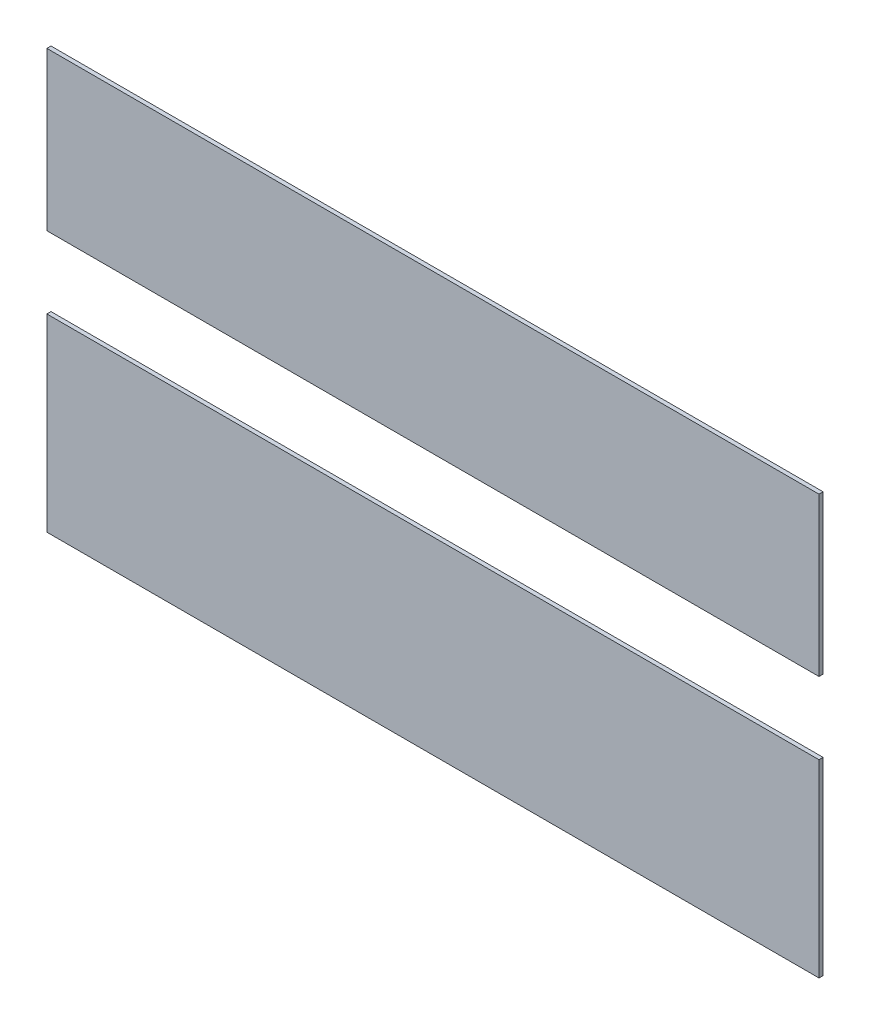
from build123d import *

# Parameters (mm, degrees)
BOSS_EXTRUDE1_DEPTH = 2
SKETCH3_W           = 374.997816797
SKETCH3_H           = 35
CUT_EXTRUDE2_DEPTH  = 10


with BuildPart() as part:
    # Sketch1 → Boss-Extrude1 (new body)
    with BuildSketch(Plane.XY):
        Polygon((10323.34448258, 14405.557974035), (9969.84448258, 14405.557974035), (9968.34448258, 14405.557974035), (9968.34448258, 14202.06060864), (10343.342299377, 14202.058856827), (10343.342299377, 14405.557974035), align=None)
    extrude(amount=BOSS_EXTRUDE1_DEPTH)

    # Sketch3 → Cut-Extrude2 (cut)
    with BuildSketch(Plane.XY.offset(2)):
        with Locations((10155.843390978, 14311.357974035)):
            Rectangle(SKETCH3_W, SKETCH3_H)
    extrude(amount=-CUT_EXTRUDE2_DEPTH, mode=Mode.SUBTRACT)


with BuildPart() as cut_extrude2_piece_1:
    # of the separate pieces the step leaves, piece 1, a body of its own (cut_extrude2_pieces)
    add(part.part.solids().sort_by_distance((10343.342299377, 14293.857974035, 0))[0])


with BuildPart() as cut_extrude2_piece_2:
    # of the separate pieces the step leaves, piece 2, a body of its own (cut_extrude2_pieces)
    add(part.part.solids().sort_by_distance((10343.342299377, 14405.557974035, 0))[0])


solid = Compound([cut_extrude2_piece_1.part, cut_extrude2_piece_2.part])
